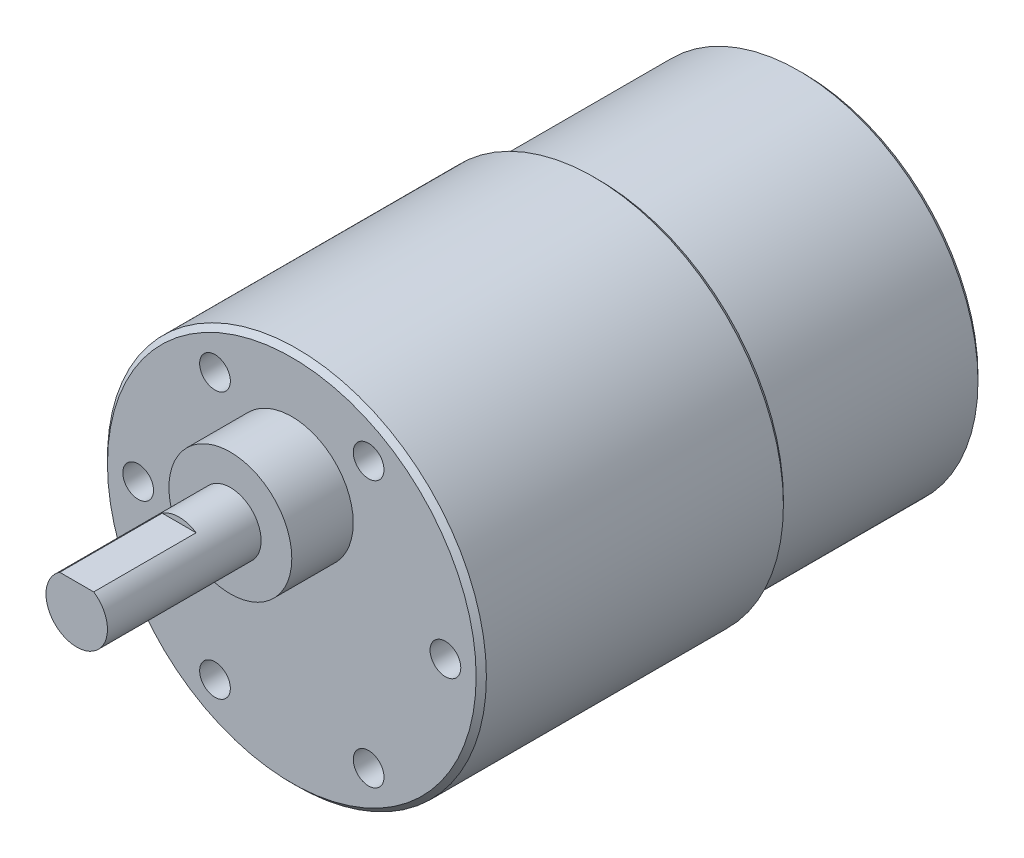
from build123d import *

# Parameters (mm, degrees)
SKETCH_1_R          = 18.5
EXTRUDE_1_DEPTH     = 50
SKETCH_2_R          = 5
EXTRUDE_2_DEPTH     = 6
EXTRUDE_3_DEPTH     = 21
CUT_EXTRUDE_1_DEPTH = 10
SKETCH_5_R          = 6
EXTRUDE_4_DEPTH     = 6
CUT_EXTRUDE_START   = -30
CUT_EXTRUDE_2_DEPTH = 20
SKETCH_8_R          = 1.5
CUT_EXTRUDE_3_DEPTH = 10


with BuildPart() as part:
    # 草图1 → 凸台-拉伸1 (new body)
    with BuildSketch(Plane.XY):
        Circle(SKETCH_1_R)
    extrude(amount=-EXTRUDE_1_DEPTH)

    # 草图2 → 凸台-拉伸2 (add)
    with BuildSketch(Plane(origin=(0, 0, -50), x_dir=(-1, 0, 0), z_dir=(0, 0, -1))):
        Circle(SKETCH_2_R)
    extrude(amount=EXTRUDE_2_DEPTH)

    # 草图1<3> → 凸台-拉伸3 (add)
    with BuildSketch(Plane.XY):
        with BuildLine():
            ThreePointArc((0, 10), (-3, 7), (0, 4))
            Line((0, 4), (0, 10))
        make_face()
        with BuildLine():
            Line((0, 10), (0, 4))
            ThreePointArc((0, 4), (2.121320344, 4.878679656), (3, 7))
            ThreePointArc((3, 7), (2.121320344, 9.121320344), (0, 10))
        make_face()
    extrude(amount=EXTRUDE_3_DEPTH)

    # 草图4 → 切除-拉伸1 (cut)
    with BuildSketch(Plane.XY.offset(21)):
        Polygon((-80.661429966, 9.5), (-1.658312395, 9.5), (1.658312395, 9.5), (80.661429966, 9.5), (80.661429966, 167.506235142), (-80.661429966, 167.506235142), align=None)
    extrude(amount=-CUT_EXTRUDE_1_DEPTH, mode=Mode.SUBTRACT)

    # 草图5 → 凸台-拉伸4 (add)
    with BuildSketch(Plane.XY):
        with Locations((0, 7)):
            Circle(SKETCH_5_R)
    extrude(amount=EXTRUDE_4_DEPTH)

    # 草图1<5> → 切除-拉伸2 (cut)
    with BuildSketch(Plane.XY.offset(CUT_EXTRUDE_START)):
        with BuildLine():
            ThreePointArc((0, 18.5), (-18.5, 0), (0, -18.5))
            Line((0, -18.5), (0, -17.5))
            ThreePointArc((0, -17.5), (-17.5, 0), (0, 17.5))
            Line((0, 17.5), (0, 18.5))
        make_face()
        with BuildLine():
            Line((0, -17.5), (0, -18.5))
            ThreePointArc((0, -18.5), (13.081475452, -13.081475452), (18.5, 0))
            ThreePointArc((18.5, 0), (13.081475452, 13.081475452), (0, 18.5))
            Line((0, 18.5), (0, 17.5))
            ThreePointArc((0, 17.5), (12.374368671, 12.374368671), (17.5, 0))
            ThreePointArc((17.5, 0), (12.374368671, -12.374368671), (0, -17.5))
        make_face()
    extrude(amount=-CUT_EXTRUDE_2_DEPTH, mode=Mode.SUBTRACT)

    # 倒角1: read off the stored shape, not the designer's step
    # 倒角1 outline → 倒角1 (revolve, cut)
    with BuildSketch(Plane.XZ):
        Polygon((5, -55.5), (4.5, -56), (5, -56), align=None)
        Polygon((17.5, -49.5), (17, -50), (17.5, -50), align=None)
        Polygon((18.5, -29.5), (18, -30), (18.5, -30), align=None)
        Polygon((18, 0), (18.5, -0.5), (18.5, 0), align=None)
    revolve(axis=Axis((0, 0, 0), (0, 0, 1)), mode=Mode.SUBTRACT)

    # 草图8 → 切除-拉伸3 (cut)
    with BuildSketch(Plane.XY):
        with Locations((15, 0)):
            Circle(SKETCH_8_R)
        with Locations((7.5, -12.990381057)):
            Circle(SKETCH_8_R)
        with Locations((-7.5, -12.990381057)):
            Circle(SKETCH_8_R)
        with Locations((-15, 0)):
            Circle(SKETCH_8_R)
        with Locations((-7.5, 12.990381057)):
            Circle(SKETCH_8_R)
        with Locations((7.5, 12.990381057)):
            Circle(SKETCH_8_R)
    extrude(amount=-CUT_EXTRUDE_3_DEPTH, mode=Mode.SUBTRACT)


solid = part.part
